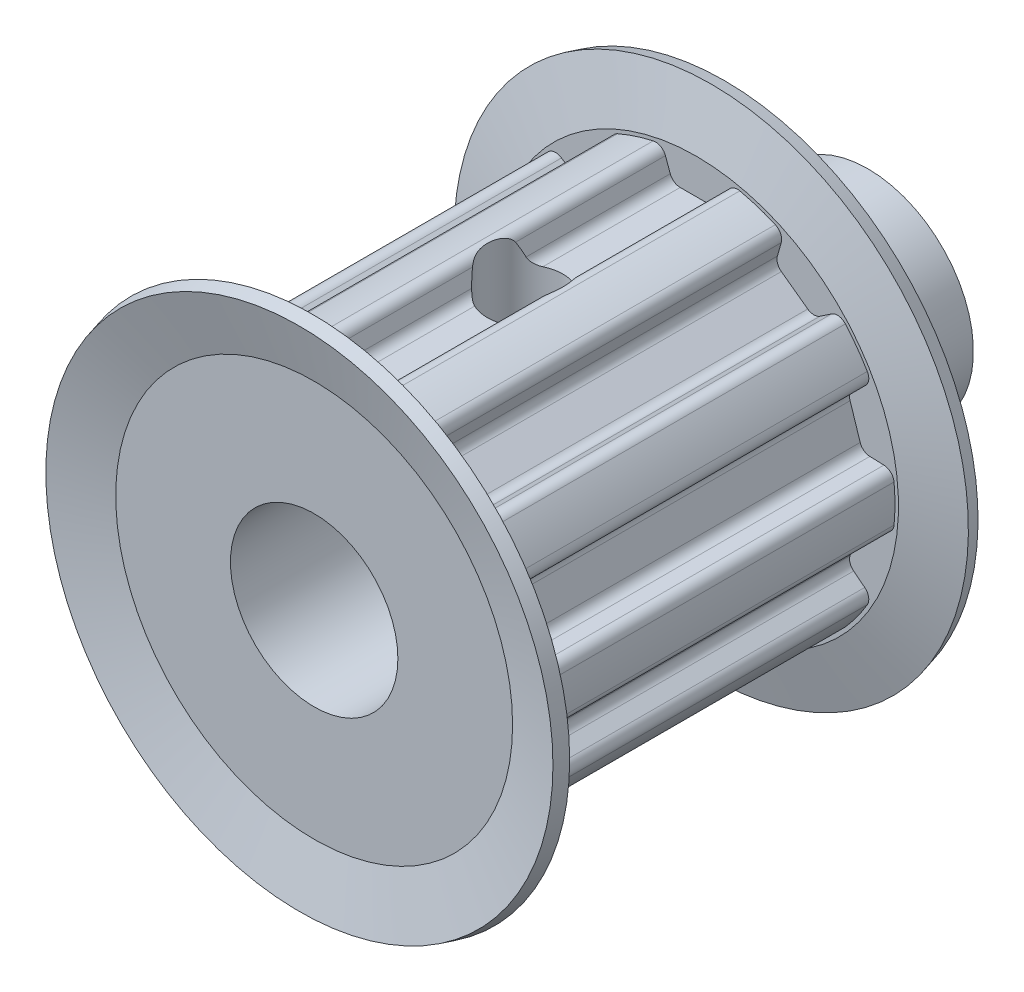
from build123d import *

# Parameters (mm, degrees)
SKETCH5_W                   = 15
SKETCH5_H                   = 7.525
CUT_EXTRUDE_START           = -15
CUT_EXTRUDE_1_OUTLINE_R     = 3.175
CUT_EXTRUDE_1_DEPTH         = 15
CUT_EXTRUDE_START_2         = -21
CUT_EXTRUDE_1_2_OUTLINE_R   = 4
CUT_EXTRUDE_1_2_OUTLINE_R_2 = 3.175
CUT_EXTRUDE_1_2_DEPTH       = 6
CUT_EXTRUDE_START_3         = -14.5
CUT_EXTRUDE_1_3_DEPTH       = 14
CUT_EXTRUDE_START_4         = 2
CUT_EXTRUDE_1_5_OUTLINE_R   = 1.433256124
CUT_EXTRUDE_1_5_DEPTH       = 5.353381724


with BuildPart() as part:
    # Sketch5 → body (revolve)
    with BuildSketch(Plane(origin=(0, 0, 0), x_dir=(0, 0, -1), z_dir=(1, 0, 0)), mode=Mode.PRIVATE) as body_sk:
        with Locations((7.5, 3.7625)):
            Rectangle(SKETCH5_W, SKETCH5_H)
    revolve(body_sk.sketch.rotate(Axis((0, 0, 0), (0, 0, 1)), 270), axis=Axis((0, 0, 0), (0, 0, 1)))

    # Вырез-Вытянуть1: read off the stored shape, not the designer's step
    # Вырез-Вытянуть1 outline → Вырез-Вытянуть1 (cut)
    with BuildSketch(Plane.XY.offset(CUT_EXTRUDE_START)):
        Circle(CUT_EXTRUDE_1_OUTLINE_R)
    extrude(amount=CUT_EXTRUDE_1_DEPTH, mode=Mode.SUBTRACT)

    # Cut-Extrude 1 2 outline → Cut-Extrude 1 2 (add)
    with BuildSketch(Plane.XY.offset(CUT_EXTRUDE_START_2)):
        Circle(CUT_EXTRUDE_1_2_OUTLINE_R)
        Circle(CUT_EXTRUDE_1_2_OUTLINE_R_2, mode=Mode.SUBTRACT)
    extrude(amount=CUT_EXTRUDE_1_2_DEPTH)

    # Cut-Extrude 1 3 outline → Cut-Extrude 1 3 (cut)
    with BuildSketch(Plane.XY.offset(CUT_EXTRUDE_START_3)):
        with BuildLine():
            ThreePointArc((1.178506304, 7.090189781), (1.362296798, 7.304241747), (1.641646979, 7.343747013))
            ThreePointArc((1.641646979, 7.343747013), (0, 7.525), (-1.641646979, 7.343747013))
            ThreePointArc((-1.641646979, 7.343747013), (-1.362296798, 7.304241747), (-1.178506304, 7.090189781))
            Line((-1.178506304, 7.090189781), (-0.995794033, 6.588191943))
            ThreePointArc((-0.995794033, 6.588191943), (-0.84934756, 6.397339182), (-0.619916985, 6.325))
            Line((-0.619916985, 6.325), (0.619916985, 6.325))
            ThreePointArc((0.619916985, 6.325), (0.84934756, 6.397339182), (0.995794033, 6.588191943))
            Line((0.995794033, 6.588191943), (1.178506304, 7.090189781))
        make_face()
        with BuildLine():
            ThreePointArc((5.644666496, 4.976280253), (4.423084023, 6.087852883), (2.988425886, 6.90615202))
            ThreePointArc((2.988425886, 6.90615202), (3.191204317, 6.709993671), (3.214077361, 6.428792651))
            Line((3.214077361, 6.428792651), (3.066827768, 5.915272291))
            ThreePointArc((3.066827768, 5.915272291), (3.073125016, 5.674790087), (3.216218345, 5.481410551))
            Line((3.216218345, 5.481410551), (4.219265096, 4.752654428))
            ThreePointArc((4.219265096, 4.752654428), (4.447398235, 4.676322148), (4.678056359, 4.744646197))
            Line((4.678056359, 4.744646197), (5.120940617, 5.043375401))
            ThreePointArc((5.120940617, 5.043375401), (5.395446839, 5.108517737), (5.644666496, 4.976280253))
        make_face()
        with BuildLine():
            ThreePointArc((-3.214077361, 6.428792651), (-3.191204317, 6.709993671), (-2.988425886, 6.90615202))
            ThreePointArc((-2.988425886, 6.90615202), (-4.423084023, 6.087852883), (-5.644666496, 4.976280253))
            ThreePointArc((-5.644666496, 4.976280253), (-5.395446839, 5.108517737), (-5.120940617, 5.043375401))
            Line((-5.120940617, 5.043375401), (-4.678056359, 4.744646197))
            ThreePointArc((-4.678056359, 4.744646197), (-4.447398235, 4.676322148), (-4.219265096, 4.752654428))
            Line((-4.219265096, 4.752654428), (-3.216218345, 5.481410551))
            ThreePointArc((-3.216218345, 5.481410551), (-3.073125016, 5.674790087), (-3.066827768, 5.915272291))
            Line((-3.066827768, 5.915272291), (-3.214077361, 6.428792651))
        make_face()
        with BuildLine():
            ThreePointArc((7.491615266, 0.708043573), (7.156700285, 2.325352883), (6.477021636, 3.830641686))
            ThreePointArc((6.477021636, 3.830641686), (6.525773848, 3.552756077), (6.378992717, 3.311815235))
            Line((6.378992717, 3.311815235), (5.958025599, 2.982919676))
            ThreePointArc((5.958025599, 2.982919676), (5.821768286, 2.784664057), (5.823867582, 2.544108577))
            Line((5.823867582, 2.544108577), (6.206997349, 1.364956402))
            ThreePointArc((6.206997349, 1.364956402), (6.346693946, 1.169108995), (6.573460157, 1.088806868))
            Line((6.573460157, 1.088806868), (7.107349669, 1.070163036))
            ThreePointArc((7.107349669, 1.070163036), (7.367719572, 0.961513584), (7.491615266, 0.708043573))
        make_face()
        with BuildLine():
            ThreePointArc((-6.378992717, 3.311815235), (-6.525773848, 3.552756077), (-6.477021636, 3.830641686))
            ThreePointArc((-6.477021636, 3.830641686), (-7.156700285, 2.325352883), (-7.491615266, 0.708043573))
            ThreePointArc((-7.491615266, 0.708043573), (-7.367719572, 0.961513584), (-7.107349669, 1.070163036))
            Line((-7.107349669, 1.070163036), (-6.573460157, 1.088806868))
            ThreePointArc((-6.573460157, 1.088806868), (-6.346693946, 1.169108995), (-6.206997349, 1.364956402))
            Line((-6.206997349, 1.364956402), (-5.823867582, 2.544108577))
            ThreePointArc((-5.823867582, 2.544108577), (-5.821768286, 2.784664057), (-5.958025599, 2.982919676))
            Line((-5.958025599, 2.982919676), (-6.378992717, 3.311815235))
        make_face()
        with BuildLine():
            ThreePointArc((6.477021636, -3.830641686), (7.156700285, -2.325352883), (7.491615266, -0.708043573))
            ThreePointArc((7.491615266, -0.708043573), (7.367719572, -0.961513584), (7.107349669, -1.070163036))
            Line((7.107349669, -1.070163036), (6.573460157, -1.088806868))
            ThreePointArc((6.573460157, -1.088806868), (6.346693946, -1.169108995), (6.206997349, -1.364956402))
            Line((6.206997349, -1.364956402), (5.823867582, -2.544108577))
            ThreePointArc((5.823867582, -2.544108577), (5.821768286, -2.784664057), (5.958025599, -2.982919676))
            Line((5.958025599, -2.982919676), (6.378992717, -3.311815235))
            ThreePointArc((6.378992717, -3.311815235), (6.525773848, -3.552756077), (6.477021636, -3.830641686))
        make_face()
        with BuildLine():
            ThreePointArc((-7.107349669, -1.070163036), (-7.367719572, -0.961513584), (-7.491615266, -0.708043573))
            ThreePointArc((-7.491615266, -0.708043573), (-7.156700285, -2.325352883), (-6.477021636, -3.830641686))
            ThreePointArc((-6.477021636, -3.830641686), (-6.525773848, -3.552756077), (-6.378992717, -3.311815235))
            Line((-6.378992717, -3.311815235), (-5.958025599, -2.982919676))
            ThreePointArc((-5.958025599, -2.982919676), (-5.821768286, -2.784664057), (-5.823867582, -2.544108577))
            Line((-5.823867582, -2.544108577), (-6.206997349, -1.364956402))
            ThreePointArc((-6.206997349, -1.364956402), (-6.346693946, -1.169108995), (-6.573460157, -1.088806868))
            Line((-6.573460157, -1.088806868), (-7.107349669, -1.070163036))
        make_face()
        with BuildLine():
            ThreePointArc((2.988425886, -6.90615202), (4.423084023, -6.087852883), (5.644666496, -4.976280253))
            ThreePointArc((5.644666496, -4.976280253), (5.395446839, -5.108517737), (5.120940617, -5.043375401))
            Line((5.120940617, -5.043375401), (4.678056359, -4.744646197))
            ThreePointArc((4.678056359, -4.744646197), (4.447398235, -4.676322148), (4.219265096, -4.752654428))
            Line((4.219265096, -4.752654428), (3.216218345, -5.481410551))
            ThreePointArc((3.216218345, -5.481410551), (3.073125016, -5.674790087), (3.066827768, -5.915272291))
            Line((3.066827768, -5.915272291), (3.214077361, -6.428792651))
            ThreePointArc((3.214077361, -6.428792651), (3.191204317, -6.709993671), (2.988425886, -6.90615202))
        make_face()
        with BuildLine():
            ThreePointArc((-5.120940617, -5.043375401), (-5.395446839, -5.108517737), (-5.644666496, -4.976280253))
            ThreePointArc((-5.644666496, -4.976280253), (-4.423084023, -6.087852883), (-2.988425886, -6.90615202))
            ThreePointArc((-2.988425886, -6.90615202), (-3.191204317, -6.709993671), (-3.214077361, -6.428792651))
            Line((-3.214077361, -6.428792651), (-3.066827768, -5.915272291))
            ThreePointArc((-3.066827768, -5.915272291), (-3.073125016, -5.674790087), (-3.216218345, -5.481410551))
            Line((-3.216218345, -5.481410551), (-4.219265096, -4.752654428))
            ThreePointArc((-4.219265096, -4.752654428), (-4.447398235, -4.676322148), (-4.678056359, -4.744646197))
            Line((-4.678056359, -4.744646197), (-5.120940617, -5.043375401))
        make_face()
        with BuildLine():
            ThreePointArc((-1.641646979, -7.343747013), (0, -7.525), (1.641646979, -7.343747013))
            ThreePointArc((1.641646979, -7.343747013), (1.362296798, -7.304241747), (1.178506304, -7.090189781))
            Line((1.178506304, -7.090189781), (0.995794033, -6.588191943))
            ThreePointArc((0.995794033, -6.588191943), (0.84934756, -6.397339182), (0.619916985, -6.325))
            Line((0.619916985, -6.325), (-0.619916985, -6.325))
            ThreePointArc((-0.619916985, -6.325), (-0.84934756, -6.397339182), (-0.995794033, -6.588191943))
            Line((-0.995794033, -6.588191943), (-1.178506304, -7.090189781))
            ThreePointArc((-1.178506304, -7.090189781), (-1.362296798, -7.304241747), (-1.641646979, -7.343747013))
        make_face()
    extrude(amount=CUT_EXTRUDE_1_3_DEPTH, mode=Mode.SUBTRACT)

    # Cut-Extrude 1 4 outline → Cut-Extrude 1 4 (revolve)
    with BuildSketch(Plane.XZ):
        Polygon((7.525, 0), (7.525, -0.5), (7.658974596, -0.5), (9.75, 0.060288568), (9.616025404, 0.560288568), align=None)
        Polygon((7.658974596, -14.5), (7.525, -14.5), (7.525, -15), (9.616025404, -15.560288568), (9.75, -15.060288568), align=None)
    revolve(axis=Axis((0, 0, 0), (0, 0, 1)))

    # Cut-Extrude 1 5 outline → Cut-Extrude 1 5 (cut)
    with BuildSketch(Plane(origin=(0, 0, 0), x_dir=(1, 0, 0), z_dir=(0, 1, 0)).offset(CUT_EXTRUDE_START_4)):
        with Locations((0, 8)):
            Circle(CUT_EXTRUDE_1_5_OUTLINE_R)
    extrude(amount=CUT_EXTRUDE_1_5_DEPTH, mode=Mode.SUBTRACT)


solid = part.part
